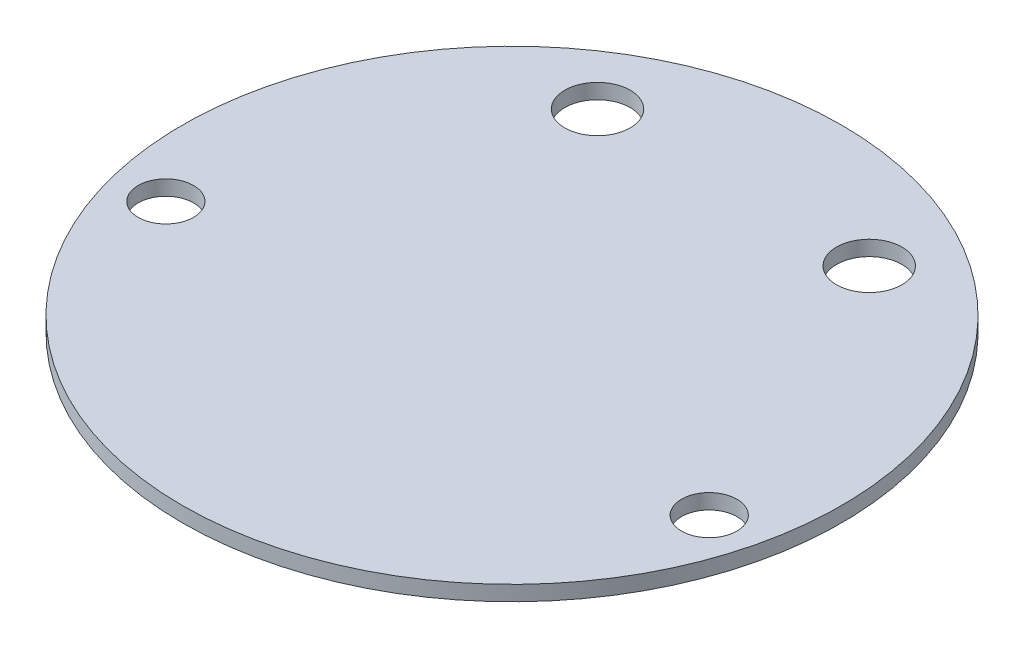
from build123d import *

# Parameters (mm, degrees)
SKETCH1_R           = 32.75
SKETCH1_R_2         = 2.75
SKETCH1_R_3         = 3.25
BOSS_EXTRUDE1_DEPTH = 1.5


with BuildPart() as part:
    # Sketch1 → Boss-Extrude1 (new body)
    with BuildSketch(Plane(origin=(0, 0, 0), x_dir=(1, 0, 0), z_dir=(0, 1, 0))):
        Circle(SKETCH1_R)
        with Locations((-27, -7.4)):
            Circle(SKETCH1_R_2, mode=Mode.SUBTRACT)
        with Locations((27, -7.4)):
            Circle(SKETCH1_R_2, mode=Mode.SUBTRACT)
        with Locations((-13.5, 22)):
            Circle(SKETCH1_R_3, mode=Mode.SUBTRACT)
        with Locations((13.5, 22)):
            Circle(SKETCH1_R_3, mode=Mode.SUBTRACT)
    extrude(amount=BOSS_EXTRUDE1_DEPTH)


solid = part.part
